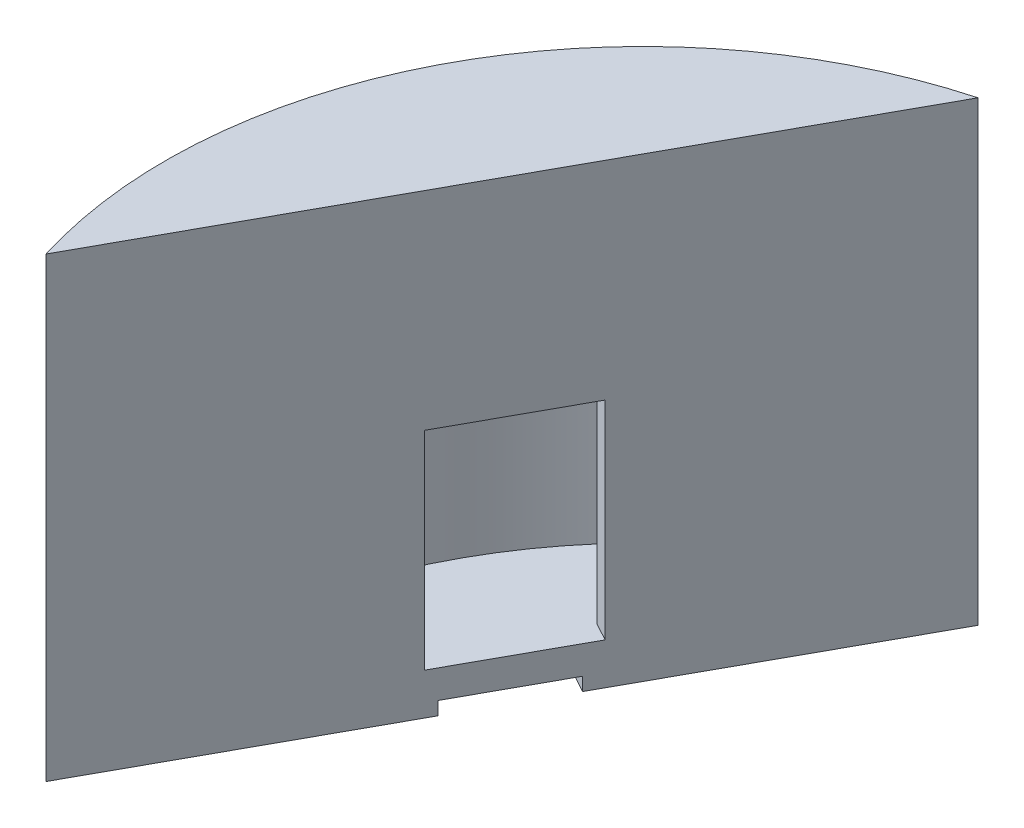
from build123d import *

# Parameters (mm, degrees)
SKETCH1_R           = 73.025
SKETCH1_R_2         = 69.85
BOSS_EXTRUDE1_DEPTH = 63.5
BOSS_EXTRUDE2_START = 6.35
SKETCH2_R           = 73.025
BOSS_EXTRUDE2_DEPTH = 6.35
BOSS_EXTRUDE3_DEPTH = 63.5
CUT_EXTRUDE2_START  = -63.5
CUT_EXTRUDE2_DEPTH  = 57.15
CUT_EXTRUDE4_START  = 19.05
SKETCH6_W           = 20.32
SKETCH6_H           = 31.75
CUT_EXTRUDE4_DEPTH  = 31.75
CUT_EXTRUDE5_DEPTH  = 1016
SKETCH8_W           = 16.256
SKETCH8_H           = 2.032
CUT_EXTRUDE6_DEPTH  = 7.62


with BuildPart() as part:
    # Sketch1 → Boss-Extrude1 (new body)
    with BuildSketch(Plane(origin=(0, 0, 0), x_dir=(1, 0, 0), z_dir=(0, 1, 0))):
        Circle(SKETCH1_R)
        Circle(SKETCH1_R_2, mode=Mode.SUBTRACT)
    extrude(amount=BOSS_EXTRUDE1_DEPTH)

    # Sketch2 → Boss-Extrude2 (add)
    with BuildSketch(Plane.XZ.offset(BOSS_EXTRUDE2_START)):
        Circle(SKETCH2_R)
    extrude(amount=-BOSS_EXTRUDE2_DEPTH)

    # Sketch3 → Boss-Extrude3 (add)
    with BuildSketch(Plane(origin=(0, 0, 0), x_dir=(1, 0, 0), z_dir=(0, 1, 0))):
        with BuildLine():
            Line((-67.615293174, -17.526968618), (-21.409243237, 66.488095205))
            ThreePointArc((-21.409243237, 66.488095205), (-61.204368783, 33.660774529), (-67.615293174, -17.526968618))
        make_face()
    extrude(amount=BOSS_EXTRUDE3_DEPTH)

    # Sketch4 → Cut-Extrude2 (cut)
    with BuildSketch(Plane(origin=(0, 63.5, 0), x_dir=(1, 0, 0), z_dir=(0, 1, 0)).offset(CUT_EXTRUDE2_START)):
        with BuildLine():
            Line((-25.79189716, 64.913793148), (-68.632882923, -12.982676212))
            ThreePointArc((-68.632882923, -12.982676212), (-61.204368783, 33.660774529), (-25.79189716, 64.913793148))
        make_face()
    extrude(amount=CUT_EXTRUDE2_DEPTH, mode=Mode.SUBTRACT)

    # Sketch6 → Cut-Extrude4 (cut)
    with BuildSketch(Plane(origin=(-42.286654796, 0, -23.256535129), x_dir=(0.48190085223737017, 0, -0.8762257520827018), z_dir=(0.8762257520827018, 0, 0.48190085223737017)).offset(CUT_EXTRUDE4_START)):
        with Locations((0.318551336, 15.875)):
            Rectangle(SKETCH6_W, SKETCH6_H)
    extrude(amount=-CUT_EXTRUDE4_DEPTH, mode=Mode.SUBTRACT)

    # Sketch7 → Cut-Extrude5 (cut)
    with BuildSketch(Plane(origin=(0, 63.5, 0), x_dir=(1, 0, 0), z_dir=(0, 1, 0))):
        Polygon((-72.609628953, -26.608018388), (-10.171407592, 86.921512047), (114.959945388, 65.80584256), (122.548753565, -33.748740716), (41.017949176, -93.980716613), (-75.603403444, -72.676842996), align=None)
    extrude(amount=-CUT_EXTRUDE5_DEPTH, mode=Mode.SUBTRACT)

    # Sketch8 → Cut-Extrude6 (cut)
    with BuildSketch(Plane(origin=(-44.512268206, 0, -24.480563294), x_dir=(0.4819008522373704, 0, -0.8762257520827017), z_dir=(0.8762257520827016, 0, 0.48190085223737034))):
        with Locations((-0.189448664, -5.334)):
            Rectangle(SKETCH8_W, SKETCH8_H)
    extrude(amount=-CUT_EXTRUDE6_DEPTH, mode=Mode.SUBTRACT)


solid = part.part
